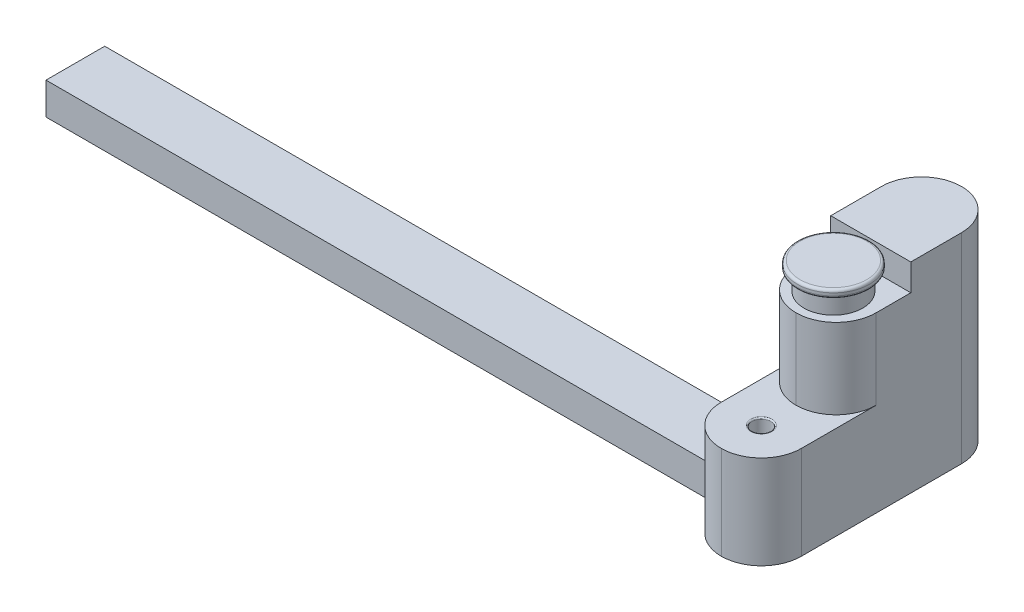
from build123d import *

# Parameters (mm, degrees)
BOSS_EXTRUDE1_START = -73.5
SKETCH1_W           = 11
SKETCH1_H           = 6
BOSS_EXTRUDE1_DEPTH = 124
SKETCH2_W           = 11
SKETCH2_H           = 6
BOSS_EXTRUDE3_DEPTH = 15
FILLET1_R           = 7.5
SKETCH4_R           = 5.5
BOSS_EXTRUDE4_DEPTH = 5
SKETCH5_R           = 6.75
BOSS_EXTRUDE5_DEPTH = 1.5
FILLET2_R           = 0.5
SKETCH6_R           = 1.75
CUT_EXTRUDE1_DEPTH  = 3
FILLET3_R           = 0.25


with BuildPart() as part:
    # Sketch1 → Boss-Extrude1 (new body)
    with BuildSketch(Plane(origin=(0, 0, 0), x_dir=(0, 0, -1), z_dir=(1, 0, 0)).offset(BOSS_EXTRUDE1_START)):
        with Locations((5.5, -3)):
            Rectangle(SKETCH1_W, SKETCH1_H)
    extrude(amount=BOSS_EXTRUDE1_DEPTH)

    # Sketch2 → Boss-Extrude3 (add)
    # profile 1 of 2: a face of its own
    with BuildSketch(Plane(origin=(50.5, 0, 0), x_dir=(0, 0, -1), z_dir=(1, 0, 0))):
        Polygon((-5, 8.5), (-5, -9), (40, -9), (40, 28.5), (23, 28.5), (23, 23.5), (9, 23.5), (9, 8.5), align=None)
        with Locations((5.5, -3)):
            Rectangle(SKETCH2_W, SKETCH2_H, mode=Mode.SUBTRACT)
    # profile 2 of 2: a face of its own
    with BuildSketch(Plane(origin=(50.5, 0, 0), x_dir=(0, 0, -1), z_dir=(1, 0, 0))):
        with Locations((5.5, -3)):
            Rectangle(SKETCH2_W, SKETCH2_H)
    extrude(amount=BOSS_EXTRUDE3_DEPTH)

    # Fillet1
    # the kernel refuses this fillet: 7.5 mm, written as the material it takes off along each edge
    with BuildSketch(Plane(origin=(50.5, 27.25, 5), x_dir=(1, 0, 0), z_dir=(0, -1, 0))) as fillet1_piece_1_section:
        with BuildLine():
            CenterArc((FILLET1_R, -FILLET1_R), FILLET1_R, 90, 90)
            Line((0, -FILLET1_R), (0, 0))
            Line((0, 0), (FILLET1_R, 0))
        make_face()
    fillet1_piece_1 = extrude(amount=55, mode=Mode.PRIVATE)
    fillet1_piece_1 = split(fillet1_piece_1, bisect_by=Plane(origin=(52.221902298, 4.25, 0), z_dir=(0, 0, 1)), keep=Keep.TOP, mode=Mode.PRIVATE)
    add(fillet1_piece_1, mode=Mode.SUBTRACT)
    with BuildSketch(Plane(origin=(50.5, 27.25, 5), x_dir=(1, 0, 0), z_dir=(0, -1, 0))) as fillet1_piece_2_section:
        with BuildLine():
            CenterArc((FILLET1_R, -FILLET1_R), FILLET1_R, 90, 90)
            Line((0, -FILLET1_R), (0, 0))
            Line((0, 0), (FILLET1_R, 0))
        make_face()
    fillet1_piece_2 = extrude(amount=55, mode=Mode.PRIVATE)
    fillet1_piece_2 = split(fillet1_piece_2, bisect_by=Plane(origin=(50.628023306, 0, -0.621369721), z_dir=(0, 1, 0)), keep=Keep.TOP, mode=Mode.PRIVATE)
    add(fillet1_piece_2, mode=Mode.SUBTRACT)
    with BuildSketch(Plane(origin=(50.5, 27.25, 5), x_dir=(1, 0, 0), z_dir=(0, -1, 0))) as fillet1_piece_3_section:
        with BuildLine():
            CenterArc((FILLET1_R, -FILLET1_R), FILLET1_R, 90, 90)
            Line((0, -FILLET1_R), (0, 0))
            Line((0, 0), (FILLET1_R, 0))
        make_face()
    fillet1_piece_3 = extrude(amount=55, mode=Mode.PRIVATE)
    fillet1_piece_3 = split(fillet1_piece_3, bisect_by=Plane(origin=(50.628023306, -6, -0.621369721), z_dir=(0, -1, 0)), keep=Keep.TOP, mode=Mode.PRIVATE)
    add(fillet1_piece_3, mode=Mode.SUBTRACT)
    with BuildSketch(Plane(origin=(65.5, 27.25, 5), x_dir=(-1, 0, 0), z_dir=(0, -1, 0))) as fillet1_piece_4:
        with BuildLine():
            CenterArc((FILLET1_R, FILLET1_R), FILLET1_R, 180, 90)
            Line((0, FILLET1_R), (0, 0))
            Line((0, 0), (FILLET1_R, 0))
        make_face()
    extrude(amount=55, mode=Mode.SUBTRACT)
    with BuildSketch(Plane(origin=(50.5, 42.25, -9), x_dir=(0, 0, -1), z_dir=(0, -1, 0))) as fillet1_piece_5:
        with BuildLine():
            CenterArc((FILLET1_R, FILLET1_R), FILLET1_R, 180, 90)
            Line((0, FILLET1_R), (0, 0))
            Line((0, 0), (FILLET1_R, 0))
        make_face()
    extrude(amount=33.75, mode=Mode.SUBTRACT)
    with BuildSketch(Plane(origin=(65.5, 42.25, -9), x_dir=(0, 0, -1), z_dir=(0, -1, 0))) as fillet1_piece_6:
        with BuildLine():
            CenterArc((FILLET1_R, -FILLET1_R), FILLET1_R, 90, 90)
            Line((0, -FILLET1_R), (0, 0))
            Line((0, 0), (FILLET1_R, 0))
        make_face()
    extrude(amount=33.75, mode=Mode.SUBTRACT)
    with BuildSketch(Plane(origin=(50.5, -27.75, -40), x_dir=(0, 0, 1), z_dir=(0, 1, 0))) as fillet1_piece_7:
        with BuildLine():
            CenterArc((FILLET1_R, FILLET1_R), FILLET1_R, 180, 90)
            Line((0, FILLET1_R), (0, 0))
            Line((0, 0), (FILLET1_R, 0))
        make_face()
    extrude(amount=75, mode=Mode.SUBTRACT)
    with BuildSketch(Plane(origin=(65.5, -27.75, -40), x_dir=(0, 0, 1), z_dir=(0, 1, 0))) as fillet1_piece_8:
        with BuildLine():
            CenterArc((FILLET1_R, -FILLET1_R), FILLET1_R, 90, 90)
            Line((0, -FILLET1_R), (0, 0))
            Line((0, 0), (FILLET1_R, 0))
        make_face()
    extrude(amount=75, mode=Mode.SUBTRACT)

    # Sketch4 → Boss-Extrude4 (add)
    with BuildSketch(Plane(origin=(0, 23.5, 0), x_dir=(1, 0, 0), z_dir=(0, 1, 0))):
        with Locations(Location((58, 16, 0), (0, 0, 270))):
            Circle(SKETCH4_R)
    extrude(amount=BOSS_EXTRUDE4_DEPTH)

    # Sketch5 → Boss-Extrude5 (add)
    with BuildSketch(Plane(origin=(0, 28.5, 0), x_dir=(1, 0, 0), z_dir=(0, 1, 0))):
        with Locations(Location((58, 16, 0), (0, 0, 270))):
            Circle(SKETCH5_R)
    extrude(amount=-BOSS_EXTRUDE5_DEPTH)

    # Fillet2
    fillet2_edges = [part.edges().sort_by_distance(p)[0] for p in [
        (58, 27, -22.75),
        (58, 28.5, -22.75),
    ]]
    fillet(fillet2_edges, radius=FILLET2_R)

    # Sketch6 → Cut-Extrude1 (cut)
    with BuildSketch(Plane(origin=(0, 8.5, 0), x_dir=(1, 0, 0), z_dir=(0, 1, 0))):
        with Locations(Location((58, 2.5, 0), (0, 0, 270))):
            Circle(SKETCH6_R)
    extrude(amount=-CUT_EXTRUDE1_DEPTH, mode=Mode.SUBTRACT)

    # Fillet3
    fillet3_edges = [part.edges().sort_by_distance(p)[0] for p in [
        (58, 5.5, -4.25),
        (58, 8.5, -4.25),
    ]]
    fillet(fillet3_edges, radius=FILLET3_R)


solid = part.part
